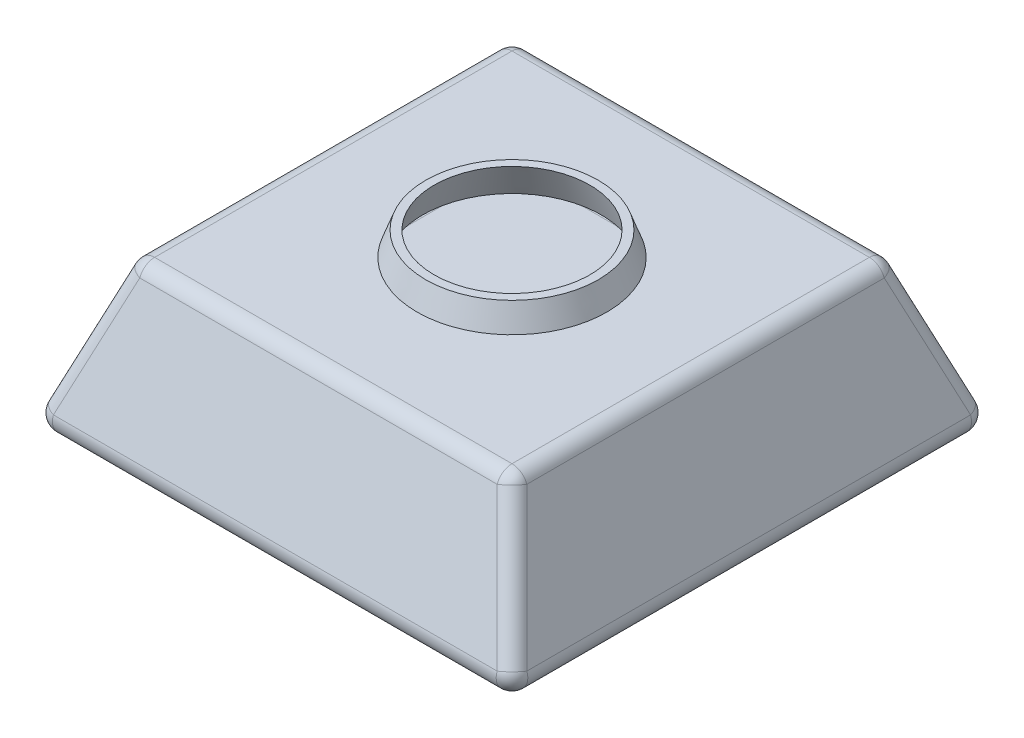
from build123d import *

# Parameters (mm, degrees)
SKETCH1_W           = 480
SKETCH1_H           = 480
BOSS_EXTRUDE1_DEPTH = 190
BOSS_EXTRUDE1_DRAFT = 20
FILLET1_R           = 20
SKETCH2_R           = 120
BOSS_EXTRUDE2_DEPTH = 30
BOSS_EXTRUDE2_TAPER = 20
SHELL1_T            = -10


with BuildPart() as part:
    # Sketch1 → Boss-Extrude1 (with draft: the straight prism first)
    with BuildSketch(Plane(origin=(0, 0, 0), x_dir=(1, 0, 0), z_dir=(0, 1, 0))):
        with Locations((240, -240)):
            Rectangle(SKETCH1_W, SKETCH1_H)
    extrude(amount=-BOSS_EXTRUDE1_DEPTH)
    # Boss-Extrude1: the draft: its side faces are tilted about the plane it starts from
    boss_extrude1_sides = [part.faces().sort_by_distance(p)[0] for p in [
        (0, -95, 240),
        (240, -95, 480),
        (480, -95, 240),
        (240, -95, 0),
    ]]
    draft(boss_extrude1_sides, Plane(origin=(0, 0, 0), x_dir=(1, 0, 0), z_dir=(0, 1, 0)), BOSS_EXTRUDE1_DRAFT)

    # Fillet1
    fillet1_edges = [part.edges().sort_by_distance(p)[0] for p in [
        (-34.577172255, -95, -34.577172255),
        (514.577172255, -95, -34.577172255),
        (549.154344511, -190, 240),
        (240, -190, -69.154344511),
        (-69.154344511, -190, 240),
        (514.577172255, -95, 514.577172255),
        (240, -190, 549.154344511),
        (-34.577172255, -95, 514.577172255),
        (240, 0, 0),
        (480, 0, 240),
        (240, 0, 480),
        (0, 0, 240),
    ]]
    fillet(fillet1_edges, radius=FILLET1_R)

    # Sketch2 → Boss-Extrude2 (add)
    with BuildSketch(Plane(origin=(0, 0, 0), x_dir=(1, 0, 0), z_dir=(0, 1, 0))):
        with Locations((240, -240)):
            Circle(SKETCH2_R)
    extrude(amount=BOSS_EXTRUDE2_DEPTH, taper=BOSS_EXTRUDE2_TAPER)

    # Shell1
    shell1_openings = [part.faces().sort_by_distance(p)[0] for p in [
        (240, 30, 240),
    ]]
    offset(amount=SHELL1_T, openings=shell1_openings, kind=Kind.INTERSECTION)


solid = part.part
